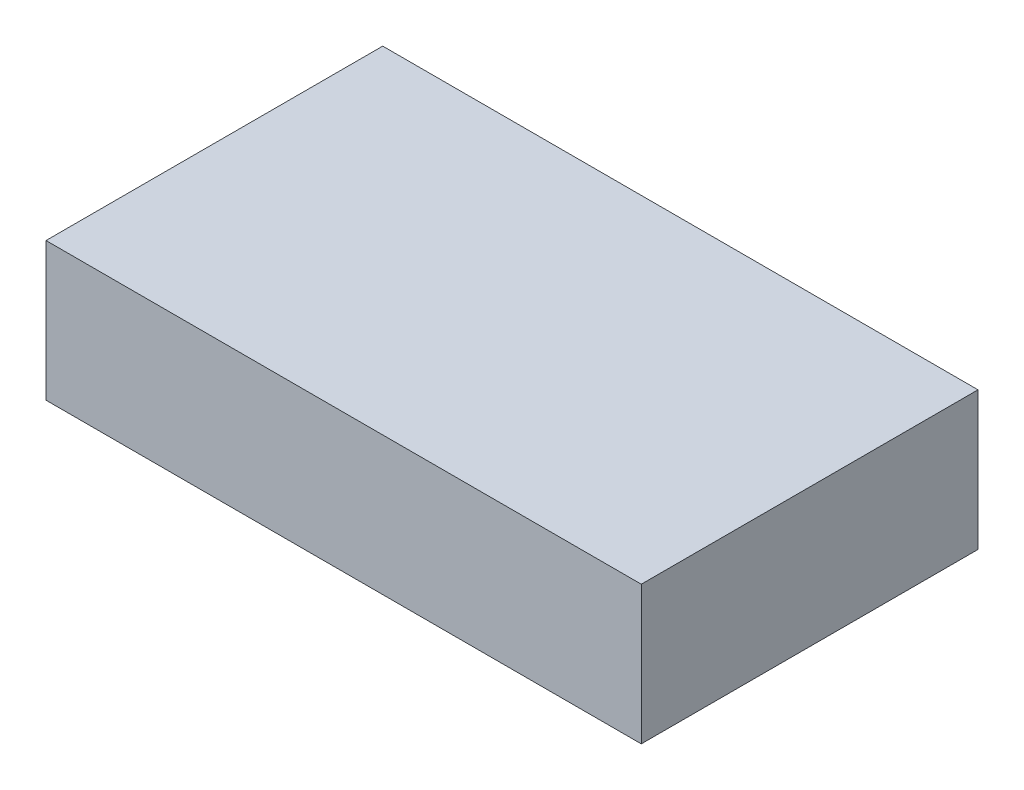
from build123d import *

# Parameters (mm, degrees)
SKETCH1_W           = 99
SKETCH1_H           = 56
BOSS_EXTRUDE1_DEPTH = 23


with BuildPart() as part:
    # Sketch1 → Boss-Extrude1 (new body)
    with BuildSketch(Plane(origin=(0, 0, 0), x_dir=(1, 0, 0), z_dir=(0, 1, 0))):
        Rectangle(SKETCH1_W, SKETCH1_H)
    extrude(amount=BOSS_EXTRUDE1_DEPTH)


solid = part.part
